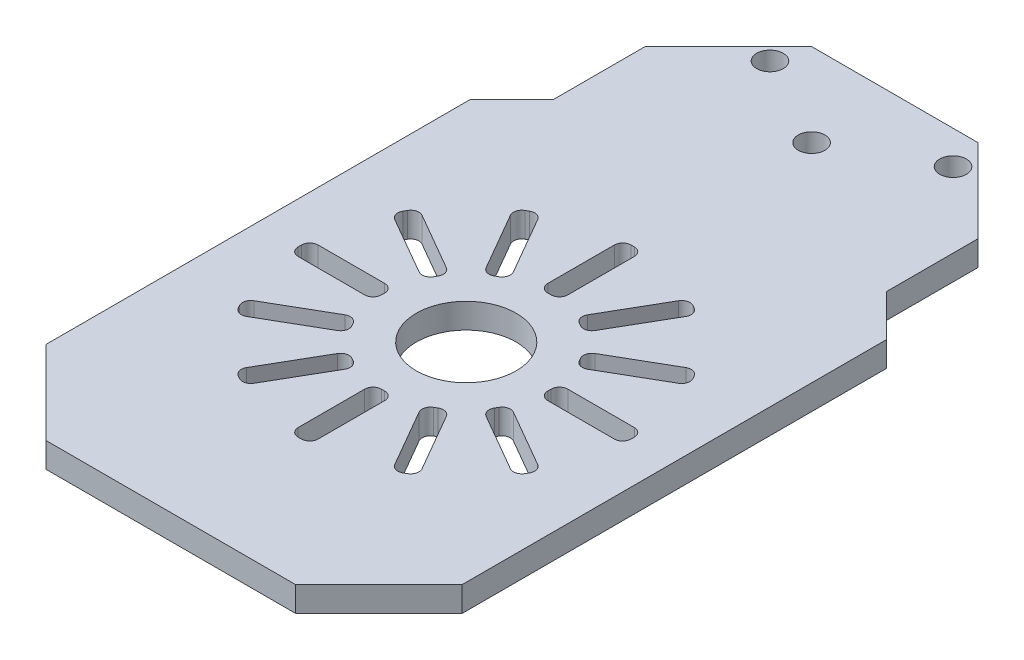
from build123d import *

# Parameters (mm, degrees)
SKETCH_1_W          = 40
SKETCH_1_H          = 16
SKETCH_1_R          = 1.6
EXTRUDE_1_DEPTH     = 3
CHAMFER_1_SIZE      = 10
SKETCH_3_R          = 6
CUT_EXTRUDE_1_DEPTH = 10


with BuildPart() as part:
    # 草图1 → 凸台-拉伸1 (new body)
    # profile 1 of 2: a face of its own
    with BuildSketch(Plane(origin=(0, 0, 0), x_dir=(1, 0, 0), z_dir=(0, 1, 0))):
        Polygon((20, -8), (-20, -8), (-25, -8), (-25, -79), (25, -79), (25, -8), align=None)
    # profile 2 of 2: a face of its own
    with BuildSketch(Plane(origin=(0, 0, 0), x_dir=(1, 0, 0), z_dir=(0, 1, 0))):
        Rectangle(SKETCH_1_W, SKETCH_1_H)
        with Locations(Location((-11, 4, 0), (0, 0, 270))):
            Circle(SKETCH_1_R, mode=Mode.SUBTRACT)
        with Locations(Location((0, -2, 0), (0, 0, 270))):
            Circle(SKETCH_1_R, mode=Mode.SUBTRACT)
        with Locations(Location((11, 4, 0), (0, 0, 270))):
            Circle(SKETCH_1_R, mode=Mode.SUBTRACT)
    extrude(amount=EXTRUDE_1_DEPTH)

    # 倒角1
    # the kernel refuses this chamfer: 10 mm, written as the material it takes off along each edge
    with BuildSketch(Plane(origin=(-25, -25.71682988, 79), x_dir=(-0.027495876610586317, 0, -0.9996219169112968), z_dir=(0, 1, 0)), Plane(origin=(-20, -25.71682988, -8), x_dir=(0.9996219169112968, 0, -0.027495876610586317), z_dir=(0, 1, 0)), Plane(origin=(20, -25.71682988, -8), x_dir=(0.027495876610586317, 0, 0.9996219169112968), z_dir=(0, 1, 0))) as chamfer_1_piece_1:
        Polygon((CHAMFER_1_SIZE * 0.999621916911, -CHAMFER_1_SIZE * 0.0274958766106), (-CHAMFER_1_SIZE * 0.0274958766106, -CHAMFER_1_SIZE * 0.999621916911), (0, 0), align=None)
    extrude(amount=54.433659759, mode=Mode.SUBTRACT)
    with BuildSketch(Plane(origin=(-25, -25.71682988, 8), x_dir=(-0.027495876610586313, 0, 0.9996219169112968), z_dir=(0, 1, 0))) as chamfer_1_piece_2_section:
        Polygon((CHAMFER_1_SIZE * 0.999621916911, CHAMFER_1_SIZE * 0.0274958766106), (-CHAMFER_1_SIZE * 0.0274958766106, CHAMFER_1_SIZE * 0.999621916911), (0, 0), align=None)
    chamfer_1_piece_2 = extrude(amount=54.433659759, mode=Mode.PRIVATE)
    chamfer_1_piece_2 = split(chamfer_1_piece_2, bisect_by=Plane(origin=(-20, 1.5, 11.934010841), z_dir=(-1, 0, 0)), keep=Keep.TOP, mode=Mode.PRIVATE)
    add(chamfer_1_piece_2, mode=Mode.SUBTRACT)
    with BuildSketch(Plane(origin=(25, -25.71682988, 8), x_dir=(-0.9996219169112968, 0, -0.027495876610586403), z_dir=(0, 1, 0))) as chamfer_1_piece_3_section:
        Polygon((CHAMFER_1_SIZE * 0.999621916911, CHAMFER_1_SIZE * 0.0274958766106), (-CHAMFER_1_SIZE * 0.0274958766106, CHAMFER_1_SIZE * 0.999621916911), (0, 0), align=None)
    chamfer_1_piece_3 = extrude(amount=54.433659759, mode=Mode.PRIVATE)
    chamfer_1_piece_3 = split(chamfer_1_piece_3, bisect_by=Plane(origin=(20, 1.5, 11.934010841), z_dir=(1, 0, 0)), keep=Keep.TOP, mode=Mode.PRIVATE)
    add(chamfer_1_piece_3, mode=Mode.SUBTRACT)
    with BuildSketch(Plane(origin=(25, -25.71682988, 79), x_dir=(0.027495876610586317, 0, -0.9996219169112968), z_dir=(0, 1, 0))) as chamfer_1_piece_4:
        Polygon((CHAMFER_1_SIZE * 0.999621916911, CHAMFER_1_SIZE * 0.0274958766106), (-CHAMFER_1_SIZE * 0.0274958766106, CHAMFER_1_SIZE * 0.999621916911), (0, 0), align=None)
    extrude(amount=54.433659759, mode=Mode.SUBTRACT)

    # 草图3 → 切除-拉伸1 (cut)
    with BuildSketch(Plane(origin=(0, 3, 0), x_dir=(1, 0, 0), z_dir=(0, 1, 0))):
        with Locations(Location((0, -43.5, 0), (0, 0, 270))):
            Circle(SKETCH_3_R)
        with BuildLine():
            Line((-6.539230485, -52.426279442), (-10.539230485, -59.354482672))
            ThreePointArc((-10.539230485, -59.354482672), (-10.639130907, -60.113301717), (-10.173205081, -60.720508076))
            Line((-10.173205081, -60.720508076), (-9.826794919, -60.920508076))
            ThreePointArc((-9.826794919, -60.920508076), (-9.067975874, -61.020408498), (-8.460769515, -60.554482672))
            Line((-8.460769515, -60.554482672), (-4.460769515, -53.626279442))
            ThreePointArc((-4.460769515, -53.626279442), (-4.360869093, -52.867460397), (-4.826794919, -52.260254038))
            Line((-4.826794919, -52.260254038), (-5.173205081, -52.060254038))
            ThreePointArc((-5.173205081, -52.060254038), (-5.932024126, -51.960353615), (-6.539230485, -52.426279442))
        make_face()
        with BuildLine():
            Line((-0.2, -53.5), (0.2, -53.5))
            ThreePointArc((0.2, -53.5), (0.907106781, -53.792893219), (1.2, -54.5))
            Line((1.2, -54.5), (1.2, -62.5))
            ThreePointArc((1.2, -62.5), (0.907106781, -63.207106781), (0.2, -63.5))
            Line((0.2, -63.5), (-0.2, -63.5))
            ThreePointArc((-0.2, -63.5), (-0.907106781, -63.207106781), (-1.2, -62.5))
            Line((-1.2, -62.5), (-1.2, -54.5))
            ThreePointArc((-1.2, -54.5), (-0.907106781, -53.792893219), (-0.2, -53.5))
        make_face()
        with BuildLine():
            Line((-10.126279442, -47.960769515), (-17.054482672, -51.960769515))
            ThreePointArc((-17.054482672, -51.960769515), (-17.520408498, -52.567975874), (-17.420508076, -53.326794919))
            Line((-17.420508076, -53.326794919), (-17.220508076, -53.673205081))
            ThreePointArc((-17.220508076, -53.673205081), (-16.613301717, -54.139130907), (-15.854482672, -54.039230485))
            Line((-15.854482672, -54.039230485), (-8.926279442, -50.039230485))
            ThreePointArc((-8.926279442, -50.039230485), (-8.460353615, -49.432024126), (-8.560254038, -48.673205081))
            Line((-8.560254038, -48.673205081), (-8.760254038, -48.326794919))
            ThreePointArc((-8.760254038, -48.326794919), (-9.367460397, -47.860869093), (-10.126279442, -47.960769515))
        make_face()
        with BuildLine():
            Line((-11, -42.3), (-19, -42.3))
            ThreePointArc((-19, -42.3), (-19.707106781, -42.592893219), (-20, -43.3))
            Line((-20, -43.3), (-20, -43.7))
            ThreePointArc((-20, -43.7), (-19.707106781, -44.407106781), (-19, -44.7))
            Line((-19, -44.7), (-11, -44.7))
            ThreePointArc((-11, -44.7), (-10.292893219, -44.407106781), (-10, -43.7))
            Line((-10, -43.7), (-10, -43.3))
            ThreePointArc((-10, -43.3), (-10.292893219, -42.592893219), (-11, -42.3))
        make_face()
        with BuildLine():
            Line((-8.926279442, -36.960769515), (-15.854482672, -32.960769515))
            ThreePointArc((-15.854482672, -32.960769515), (-16.613301717, -32.860869093), (-17.220508076, -33.326794919))
            Line((-17.220508076, -33.326794919), (-17.420508076, -33.673205081))
            ThreePointArc((-17.420508076, -33.673205081), (-17.520408498, -34.432024126), (-17.054482672, -35.039230485))
            Line((-17.054482672, -35.039230485), (-10.126279442, -39.039230485))
            ThreePointArc((-10.126279442, -39.039230485), (-9.367460397, -39.139130907), (-8.760254038, -38.673205081))
            Line((-8.760254038, -38.673205081), (-8.560254038, -38.326794919))
            ThreePointArc((-8.560254038, -38.326794919), (-8.460353615, -37.567975874), (-8.926279442, -36.960769515))
        make_face()
        with BuildLine():
            Line((-4.460769515, -33.373720558), (-8.460769515, -26.445517328))
            ThreePointArc((-8.460769515, -26.445517328), (-9.067975874, -25.979591502), (-9.826794919, -26.079491924))
            Line((-9.826794919, -26.079491924), (-10.173205081, -26.279491924))
            ThreePointArc((-10.173205081, -26.279491924), (-10.639130907, -26.886698283), (-10.539230485, -27.645517328))
            Line((-10.539230485, -27.645517328), (-6.539230485, -34.573720558))
            ThreePointArc((-6.539230485, -34.573720558), (-5.932024126, -35.039646385), (-5.173205081, -34.939745962))
            Line((-5.173205081, -34.939745962), (-4.826794919, -34.739745962))
            ThreePointArc((-4.826794919, -34.739745962), (-4.360869093, -34.132539603), (-4.460769515, -33.373720558))
        make_face()
        with BuildLine():
            Line((1.2, -32.5), (1.2, -24.5))
            ThreePointArc((1.2, -24.5), (0.907106781, -23.792893219), (0.2, -23.5))
            Line((0.2, -23.5), (-0.2, -23.5))
            ThreePointArc((-0.2, -23.5), (-0.907106781, -23.792893219), (-1.2, -24.5))
            Line((-1.2, -24.5), (-1.2, -32.5))
            ThreePointArc((-1.2, -32.5), (-0.907106781, -33.207106781), (-0.2, -33.5))
            Line((-0.2, -33.5), (0.2, -33.5))
            ThreePointArc((0.2, -33.5), (0.907106781, -33.207106781), (1.2, -32.5))
        make_face()
        with BuildLine():
            Line((6.539230485, -34.573720558), (10.539230485, -27.645517328))
            ThreePointArc((10.539230485, -27.645517328), (10.639130907, -26.886698283), (10.173205081, -26.279491924))
            Line((10.173205081, -26.279491924), (9.826794919, -26.079491924))
            ThreePointArc((9.826794919, -26.079491924), (9.067975874, -25.979591502), (8.460769515, -26.445517328))
            Line((8.460769515, -26.445517328), (4.460769515, -33.373720558))
            ThreePointArc((4.460769515, -33.373720558), (4.360869093, -34.132539603), (4.826794919, -34.739745962))
            Line((4.826794919, -34.739745962), (5.173205081, -34.939745962))
            ThreePointArc((5.173205081, -34.939745962), (5.932024126, -35.039646385), (6.539230485, -34.573720558))
        make_face()
        with BuildLine():
            Line((10.126279442, -39.039230485), (17.054482672, -35.039230485))
            ThreePointArc((17.054482672, -35.039230485), (17.520408498, -34.432024126), (17.420508076, -33.673205081))
            Line((17.420508076, -33.673205081), (17.220508076, -33.326794919))
            ThreePointArc((17.220508076, -33.326794919), (16.613301717, -32.860869093), (15.854482672, -32.960769515))
            Line((15.854482672, -32.960769515), (8.926279442, -36.960769515))
            ThreePointArc((8.926279442, -36.960769515), (8.460353615, -37.567975874), (8.560254038, -38.326794919))
            Line((8.560254038, -38.326794919), (8.760254038, -38.673205081))
            ThreePointArc((8.760254038, -38.673205081), (9.367460397, -39.139130907), (10.126279442, -39.039230485))
        make_face()
        with BuildLine():
            Line((11, -44.7), (19, -44.7))
            ThreePointArc((19, -44.7), (19.707106781, -44.407106781), (20, -43.7))
            Line((20, -43.7), (20, -43.3))
            ThreePointArc((20, -43.3), (19.707106781, -42.592893219), (19, -42.3))
            Line((19, -42.3), (11, -42.3))
            ThreePointArc((11, -42.3), (10.292893219, -42.592893219), (10, -43.3))
            Line((10, -43.3), (10, -43.7))
            ThreePointArc((10, -43.7), (10.292893219, -44.407106781), (11, -44.7))
        make_face()
        with BuildLine():
            Line((8.926279442, -50.039230485), (15.854482672, -54.039230485))
            ThreePointArc((15.854482672, -54.039230485), (16.613301717, -54.139130907), (17.220508076, -53.673205081))
            Line((17.220508076, -53.673205081), (17.420508076, -53.326794919))
            ThreePointArc((17.420508076, -53.326794919), (17.520408498, -52.567975874), (17.054482672, -51.960769515))
            Line((17.054482672, -51.960769515), (10.126279442, -47.960769515))
            ThreePointArc((10.126279442, -47.960769515), (9.367460397, -47.860869093), (8.760254038, -48.326794919))
            Line((8.760254038, -48.326794919), (8.560254038, -48.673205081))
            ThreePointArc((8.560254038, -48.673205081), (8.460353615, -49.432024126), (8.926279442, -50.039230485))
        make_face()
        with BuildLine():
            Line((4.460769515, -53.626279442), (8.460769515, -60.554482672))
            ThreePointArc((8.460769515, -60.554482672), (9.067975874, -61.020408498), (9.826794919, -60.920508076))
            Line((9.826794919, -60.920508076), (10.173205081, -60.720508076))
            ThreePointArc((10.173205081, -60.720508076), (10.639130907, -60.113301717), (10.539230485, -59.354482672))
            Line((10.539230485, -59.354482672), (6.539230485, -52.426279442))
            ThreePointArc((6.539230485, -52.426279442), (5.932024126, -51.960353615), (5.173205081, -52.060254038))
            Line((5.173205081, -52.060254038), (4.826794919, -52.260254038))
            ThreePointArc((4.826794919, -52.260254038), (4.360869093, -52.867460397), (4.460769515, -53.626279442))
        make_face()
    extrude(amount=-CUT_EXTRUDE_1_DEPTH, mode=Mode.SUBTRACT)


solid = part.part
